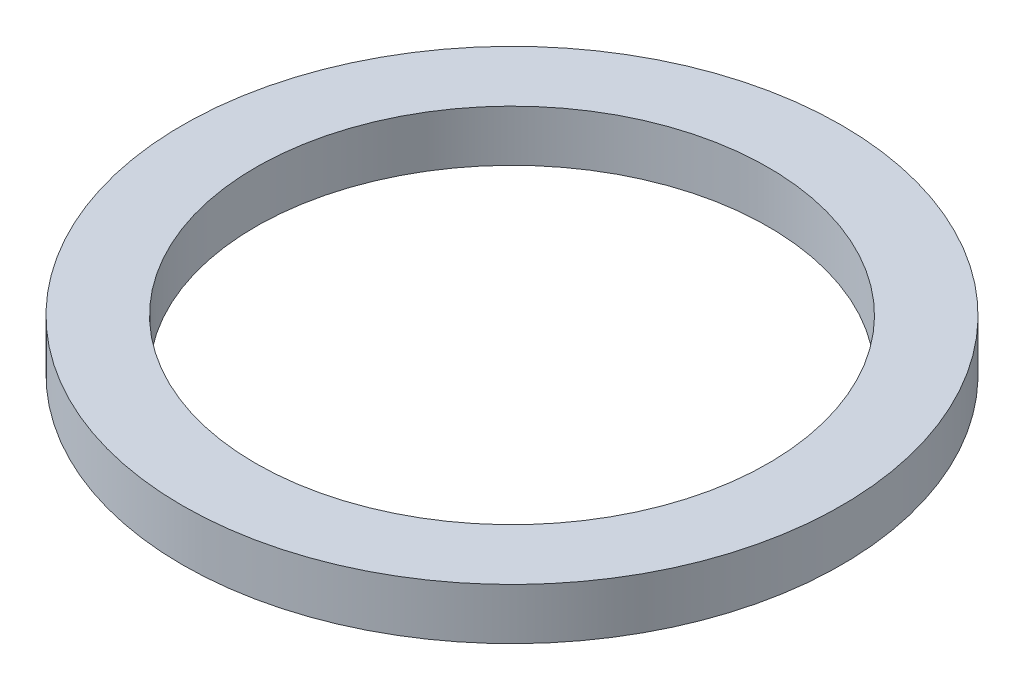
from build123d import *

# Parameters (mm, degrees)
SKETCH1_R           = 45
BOSS_EXTRUDE1_DEPTH = 7
SKETCH2_R           = 35
CUT_EXTRUDE1_DEPTH  = 65.02343321


with BuildPart() as part:
    # Sketch1 → Boss-Extrude1 (new body)
    with BuildSketch(Plane(origin=(0, 0, 0), x_dir=(1, 0, 0), z_dir=(0, 1, 0))):
        Circle(SKETCH1_R)
    extrude(amount=BOSS_EXTRUDE1_DEPTH)

    # Sketch2 → Cut-Extrude1 (cut, through all)
    with BuildSketch(Plane(origin=(0, 0, 0), x_dir=(1, 0, 0), z_dir=(0, 1, 0))):
        Circle(SKETCH2_R)
    extrude(amount=CUT_EXTRUDE1_DEPTH, mode=Mode.SUBTRACT)


solid = part.part
